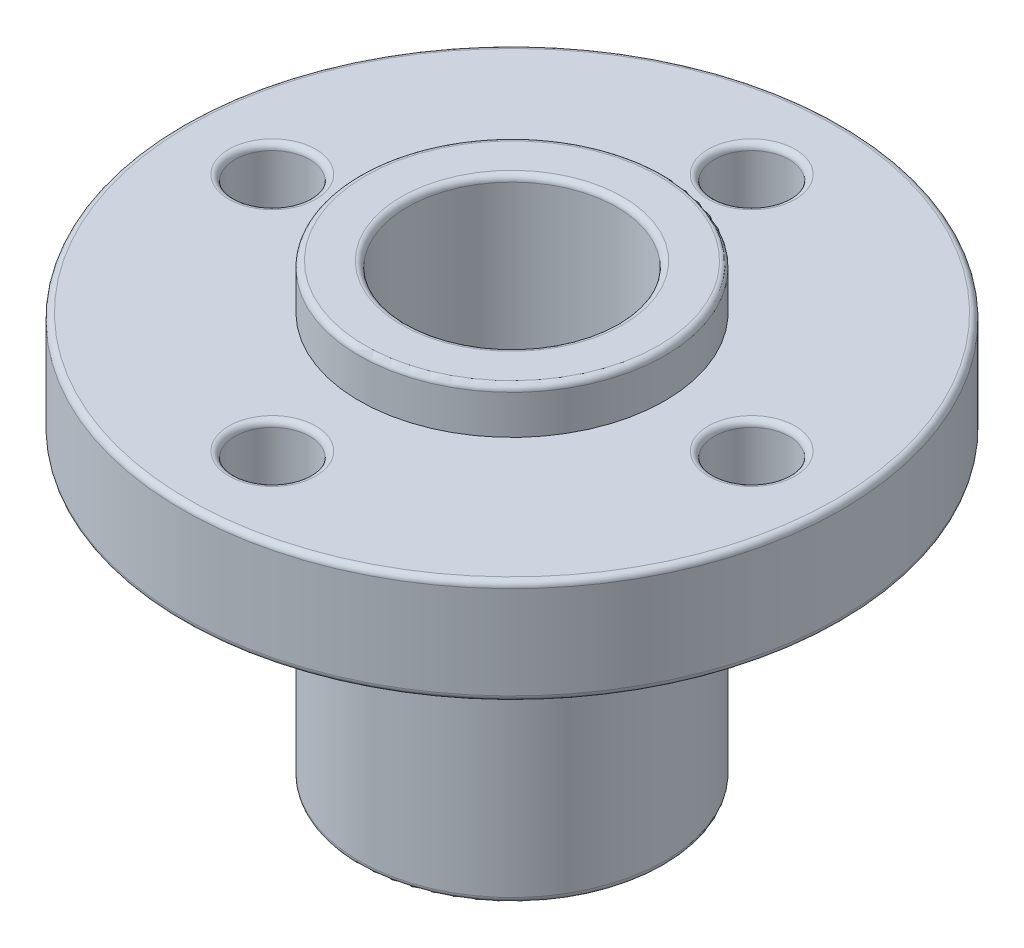
from build123d import *

# Parameters (mm, degrees)
CUT_EXTRUDE1_REACH = 22.597
SKETCH2_R          = 1.25
FILLET1_R          = 0.2


with BuildPart() as part:
    # Sketch1 → Revolve1 (revolve)
    with BuildSketch(Plane.XY):
        with BuildLine():
            Line((3.7, 3.25), (4.9, 3.25))
            ThreePointArc((4.9, 3.25), (5.041421356, 3.191421356), (5.1, 3.05))
            Line((5.1, 3.05), (5.1, 1.75))
            Line((5.1, 1.75), (10.8, 1.75))
            ThreePointArc((10.8, 1.75), (10.941421356, 1.691421356), (11, 1.55))
            Line((11, 1.55), (11, -1.55))
            ThreePointArc((11, -1.55), (10.941421356, -1.691421356), (10.8, -1.75))
            Line((10.8, -1.75), (5.1, -1.75))
            Line((5.1, -1.75), (5.1, -11.55))
            ThreePointArc((5.1, -11.55), (5.041421356, -11.691421356), (4.9, -11.75))
            Line((4.9, -11.75), (3.7, -11.75))
            ThreePointArc((3.7, -11.75), (3.558578644, -11.691421356), (3.5, -11.55))
            Line((3.5, -11.55), (3.5, 3.05))
            ThreePointArc((3.5, 3.05), (3.558578644, 3.191421356), (3.7, 3.25))
        make_face()
    revolve(axis=Axis((0, -213.929131969, 0), (0, 1, 0)))

    # Sketch2 → Cut-Extrude1 (cut, up to next)
    with BuildSketch(Plane(origin=(0, 1.75, 0), x_dir=(1, 0, 0), z_dir=(0, 1, 0)), mode=Mode.PRIVATE) as cut_extrude1_sk1:
        with Locations((8, 0)):
            Circle(SKETCH2_R)
    cut_extrude1_tool1 = extrude(cut_extrude1_sk1.sketch, amount=-CUT_EXTRUDE1_REACH, mode=Mode.PRIVATE) & part.part
    # Sketch2 → Cut-Extrude1 (cut, up to next)
    with BuildSketch(Plane(origin=(0, 1.75, 0), x_dir=(1, 0, 0), z_dir=(0, 1, 0)), mode=Mode.PRIVATE) as cut_extrude1_sk2:
        with Locations((0, -8)):
            Circle(SKETCH2_R)
    cut_extrude1_tool2 = extrude(cut_extrude1_sk2.sketch, amount=-CUT_EXTRUDE1_REACH, mode=Mode.PRIVATE) & part.part
    # Sketch2 → Cut-Extrude1 (cut, up to next)
    with BuildSketch(Plane(origin=(0, 1.75, 0), x_dir=(1, 0, 0), z_dir=(0, 1, 0)), mode=Mode.PRIVATE) as cut_extrude1_sk3:
        with Locations((-8, 0)):
            Circle(SKETCH2_R)
    cut_extrude1_tool3 = extrude(cut_extrude1_sk3.sketch, amount=-CUT_EXTRUDE1_REACH, mode=Mode.PRIVATE) & part.part
    # Sketch2 → Cut-Extrude1 (cut, up to next)
    with BuildSketch(Plane(origin=(0, 1.75, 0), x_dir=(1, 0, 0), z_dir=(0, 1, 0)), mode=Mode.PRIVATE) as cut_extrude1_sk4:
        with Locations((0, 8)):
            Circle(SKETCH2_R)
    cut_extrude1_tool4 = extrude(cut_extrude1_sk4.sketch, amount=-CUT_EXTRUDE1_REACH, mode=Mode.PRIVATE) & part.part
    add(cut_extrude1_tool1.solids().sort_by_distance((8, 1.75, 0))[0], mode=Mode.SUBTRACT)
    add(cut_extrude1_tool2.solids().sort_by_distance((0, 1.75, 8))[0], mode=Mode.SUBTRACT)
    add(cut_extrude1_tool3.solids().sort_by_distance((-8, 1.75, 0))[0], mode=Mode.SUBTRACT)
    add(cut_extrude1_tool4.solids().sort_by_distance((0, 1.75, -8))[0], mode=Mode.SUBTRACT)

    # Fillet1
    fillet1_edges = [part.edges().sort_by_distance(p)[0] for p in [
        (-9.25, -1.75, 0),
        (-1.25, -1.75, 8),
        (6.75, -1.75, 0),
        (-1.25, -1.75, -8),
        (-9.25, 1.75, 0),
        (-1.25, 1.75, 8),
        (6.75, 1.75, 0),
        (-1.25, 1.75, -8),
    ]]
    fillet(fillet1_edges, radius=FILLET1_R)


solid = part.part
